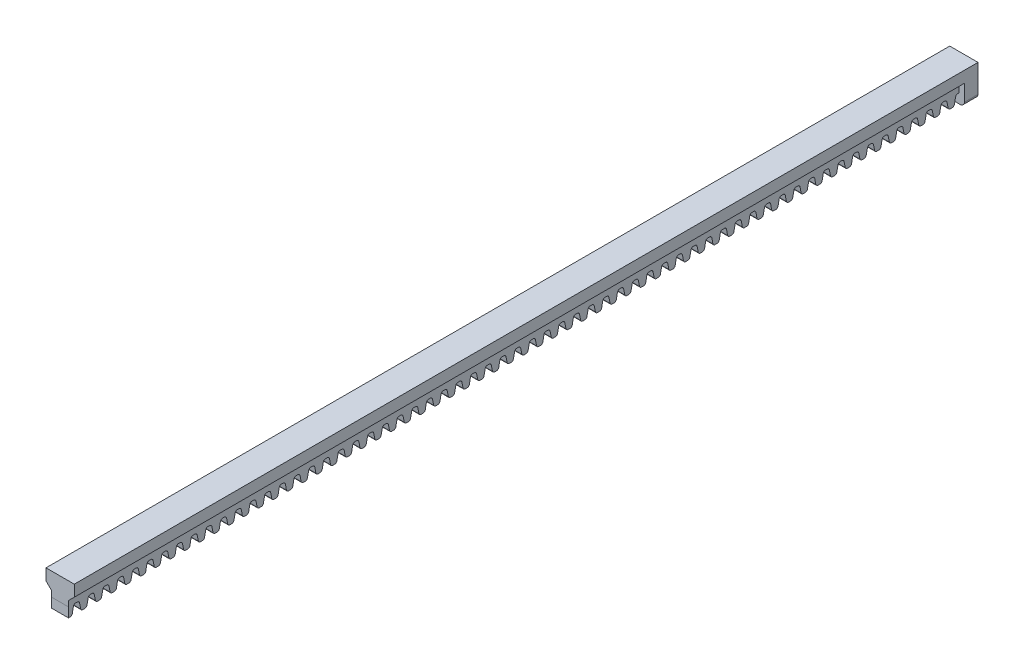
from build123d import *

# Parameters (mm, degrees)
BOSS_EXTRUDE1_DEPTH = 200
BOSS_EXTRUDE2_DEPTH = 3.81
BOSS_EXTRUDE4_DEPTH = 3


with BuildPart() as part:
    # Sketch1 → Boss-Extrude1 (new body)
    with BuildSketch(Plane.XY):
        Polygon((3.175, 2.539999459), (-3.175, 2.539999459), (-3.175, 1.407e-06), (-1.904999134, -1.269999459), (-1.904999134, -2.539999459), (1.905000866, -2.539999459), (1.905000866, -1.269999459), (3.175, -3.24e-07), align=None)
    extrude(amount=BOSS_EXTRUDE1_DEPTH)

    # Sketch2 → Boss-Extrude2 (add)
    with BuildSketch(Plane(origin=(1.905000866, 0, 0), x_dir=(0, 0, -1), z_dir=(1, 0, 0))):
        with BuildLine():
            Line((-4.064881682, -2.948372301), (-4.325343917, -4.250650878))
            ThreePointArc((-4.325343917, -4.250650878), (-4.468915028, -4.51481168), (-4.736685634, -4.651532184))
            Line((-4.736685634, -4.651532184), (-5.240538597, -4.658999528))
            ThreePointArc((-5.240538597, -4.658999528), (-5.562610137, -4.543859094), (-5.738684416, -4.250626687))
            Line((-5.738684416, -4.250626687), (-5.999125028, -2.948381715))
            ThreePointArc((-5.999125028, -2.948381715), (-6.175195708, -2.655144387), (-6.497268154, -2.539999459))
            Line((-6.497268154, -2.539999459), (-3.566740439, -2.539999459))
            ThreePointArc((-3.566740439, -2.539999459), (-3.888809172, -2.655141344), (-4.064881682, -2.948372301))
        make_face()
        with BuildLine():
            Line((-109.728874147, -2.9483723), (-109.989331543, -4.250626687))
            ThreePointArc((-109.989331543, -4.250626687), (-110.132898659, -4.514803071), (-110.400678098, -4.651532184))
            Line((-110.400678098, -4.651532184), (-110.904531062, -4.658999529))
            ThreePointArc((-110.904531062, -4.658999529), (-111.226602601, -4.543859094), (-111.40267688, -4.250626687))
            Line((-111.40267688, -4.250626687), (-111.663119376, -2.9483723))
            ThreePointArc((-111.663119376, -2.9483723), (-111.839191885, -2.655141344), (-112.161260619, -2.539999459))
            Line((-112.161260619, -2.539999459), (-109.230743229, -2.539999459))
            ThreePointArc((-109.230743229, -2.539999459), (-109.55280563, -2.655144617), (-109.728874147, -2.9483723))
        make_face()
        with BuildLine():
            Line((-6.868743777, -2.539999459), (-9.799276068, -2.539999459))
            ThreePointArc((-9.799276068, -2.539999459), (-9.477207334, -2.655141344), (-9.301134825, -2.948372301))
            Line((-9.301134825, -2.948372301), (-9.040677428, -4.250626687))
            ThreePointArc((-9.040677428, -4.250626687), (-8.897102224, -4.514800551), (-8.629321237, -4.651530257))
            Line((-8.629321237, -4.651530257), (-8.125468274, -4.658997601))
            ThreePointArc((-8.125468274, -4.658997601), (-7.803396734, -4.543857167), (-7.627322455, -4.25062476))
            Line((-7.627322455, -4.25062476), (-7.36687996, -2.948370373))
            ThreePointArc((-7.36687996, -2.948370373), (-7.190810843, -2.655139813), (-6.868743777, -2.539999459))
        make_face()
        with BuildLine():
            Line((-10.668867707, -2.9483723), (-10.929325104, -4.250626687))
            ThreePointArc((-10.929325104, -4.250626687), (-11.072900308, -4.514800551), (-11.340681295, -4.651530257))
            Line((-11.340681295, -4.651530257), (-11.844534258, -4.658997601))
            ThreePointArc((-11.844534258, -4.658997601), (-12.166605798, -4.543857167), (-12.342680077, -4.250624759))
            Line((-12.342680077, -4.250624759), (-12.603122572, -2.948370373))
            ThreePointArc((-12.603122572, -2.948370373), (-12.779190154, -2.655141071), (-13.101254785, -2.539999459))
            Line((-13.101254785, -2.539999459), (-10.17073679, -2.539999459))
            ThreePointArc((-10.17073679, -2.539999459), (-10.49279919, -2.655144617), (-10.668867707, -2.9483723))
        make_face()
        with BuildLine():
            Line((-13.472729802, -2.539999459), (-16.403262093, -2.539999459))
            ThreePointArc((-16.403262093, -2.539999459), (-16.081193359, -2.655141344), (-15.90512085, -2.948372301))
            Line((-15.90512085, -2.948372301), (-15.644663453, -4.250626687))
            ThreePointArc((-15.644663453, -4.250626687), (-15.501088249, -4.514800551), (-15.233307262, -4.651530257))
            Line((-15.233307262, -4.651530257), (-14.729454299, -4.658997601))
            ThreePointArc((-14.729454299, -4.658997601), (-14.407382759, -4.543857167), (-14.23130848, -4.25062476))
            Line((-14.23130848, -4.25062476), (-13.970865985, -2.948370373))
            ThreePointArc((-13.970865985, -2.948370373), (-13.794796867, -2.655139813), (-13.472729802, -2.539999459))
        make_face()
        with BuildLine():
            Line((-17.272898436, -2.9483723), (-17.533355832, -4.250626687))
            ThreePointArc((-17.533355832, -4.250626687), (-17.676931036, -4.514800551), (-17.944712023, -4.651530257))
            Line((-17.944712023, -4.651530257), (-18.448564987, -4.658997601))
            ThreePointArc((-18.448564987, -4.658997601), (-18.770636526, -4.543857167), (-18.946710805, -4.250624759))
            Line((-18.946710805, -4.250624759), (-19.207153301, -2.948370373))
            ThreePointArc((-19.207153301, -2.948370373), (-19.383220883, -2.655141071), (-19.705285514, -2.539999459))
            Line((-19.705285514, -2.539999459), (-16.774767518, -2.539999459))
            ThreePointArc((-16.774767518, -2.539999459), (-17.096829918, -2.655144617), (-17.272898436, -2.9483723))
        make_face()
        with BuildLine():
            Line((-20.07676053, -2.539999459), (-23.007292821, -2.539999459))
            ThreePointArc((-23.007292821, -2.539999459), (-22.685224088, -2.655141344), (-22.509151578, -2.948372301))
            Line((-22.509151578, -2.948372301), (-22.248694181, -4.250626687))
            ThreePointArc((-22.248694181, -4.250626687), (-22.105118977, -4.514800551), (-21.83733799, -4.651530257))
            Line((-21.83733799, -4.651530257), (-21.333485027, -4.658997601))
            ThreePointArc((-21.333485027, -4.658997601), (-21.011413487, -4.543857167), (-20.835339208, -4.25062476))
            Line((-20.835339208, -4.25062476), (-20.574896713, -2.948370373))
            ThreePointArc((-20.574896713, -2.948370373), (-20.398827596, -2.655139813), (-20.07676053, -2.539999459))
        make_face()
        with BuildLine():
            Line((-23.87688446, -2.9483723), (-24.137341857, -4.250626687))
            ThreePointArc((-24.137341857, -4.250626687), (-24.280917061, -4.514800551), (-24.548698048, -4.651530257))
            Line((-24.548698048, -4.651530257), (-25.052551011, -4.658997601))
            ThreePointArc((-25.052551011, -4.658997601), (-25.374622551, -4.543857167), (-25.55069683, -4.250624759))
            Line((-25.55069683, -4.250624759), (-25.811139326, -2.948370373))
            ThreePointArc((-25.811139326, -2.948370373), (-25.987206908, -2.655141071), (-26.309271538, -2.539999459))
            Line((-26.309271538, -2.539999459), (-23.378753543, -2.539999459))
            ThreePointArc((-23.378753543, -2.539999459), (-23.700815943, -2.655144617), (-23.87688446, -2.9483723))
        make_face()
        with BuildLine():
            Line((-26.680746555, -2.539999459), (-29.611278846, -2.539999459))
            ThreePointArc((-29.611278846, -2.539999459), (-29.289210112, -2.655141344), (-29.113137603, -2.948372301))
            Line((-29.113137603, -2.948372301), (-28.852680206, -4.250626687))
            ThreePointArc((-28.852680206, -4.250626687), (-28.709113091, -4.514803071), (-28.441333652, -4.651532184))
            Line((-28.441333652, -4.651532184), (-27.937480688, -4.658999529))
            ThreePointArc((-27.937480688, -4.658999529), (-27.615409148, -4.543859094), (-27.439334869, -4.250626687))
            Line((-27.439334869, -4.250626687), (-27.178892374, -2.948372301))
            ThreePointArc((-27.178892374, -2.948372301), (-27.002818095, -2.655139893), (-26.680746555, -2.539999459))
        make_face()
        with BuildLine():
            Line((-30.480877936, -2.9483723), (-30.741335332, -4.250626687))
            ThreePointArc((-30.741335332, -4.250626687), (-30.884902448, -4.514803071), (-31.152681887, -4.651532184))
            Line((-31.152681887, -4.651532184), (-31.656534851, -4.658999529))
            ThreePointArc((-31.656534851, -4.658999529), (-31.97860639, -4.543859094), (-32.154680669, -4.250626687))
            Line((-32.154680669, -4.250626687), (-32.415123165, -2.9483723))
            ThreePointArc((-32.415123165, -2.9483723), (-32.591195674, -2.655141344), (-32.913264407, -2.539999459))
            Line((-32.913264407, -2.539999459), (-29.982747018, -2.539999459))
            ThreePointArc((-29.982747018, -2.539999459), (-30.304809419, -2.655144617), (-30.480877936, -2.9483723))
        make_face()
        with BuildLine():
            Line((-33.284740031, -2.539999459), (-36.215272321, -2.539999459))
            ThreePointArc((-36.215272321, -2.539999459), (-35.893203588, -2.655141344), (-35.717131078, -2.948372301))
            Line((-35.717131078, -2.948372301), (-35.456673682, -4.250626687))
            ThreePointArc((-35.456673682, -4.250626687), (-35.313098478, -4.514800551), (-35.045317491, -4.651530257))
            Line((-35.045317491, -4.651530257), (-34.541464527, -4.658997601))
            ThreePointArc((-34.541464527, -4.658997601), (-34.219392987, -4.543857167), (-34.043318709, -4.25062476))
            Line((-34.043318709, -4.25062476), (-33.782876213, -2.948370373))
            ThreePointArc((-33.782876213, -2.948370373), (-33.606807096, -2.655139813), (-33.284740031, -2.539999459))
        make_face()
        with BuildLine():
            Line((-37.084863961, -2.9483723), (-37.345321357, -4.250626687))
            ThreePointArc((-37.345321357, -4.250626687), (-37.488896561, -4.514800551), (-37.756677548, -4.651530257))
            Line((-37.756677548, -4.651530257), (-38.260530512, -4.658997601))
            ThreePointArc((-38.260530512, -4.658997601), (-38.582602052, -4.543857167), (-38.75867633, -4.250624759))
            Line((-38.75867633, -4.250624759), (-39.019118826, -2.948370373))
            ThreePointArc((-39.019118826, -2.948370373), (-39.195186408, -2.655141071), (-39.517251039, -2.539999459))
            Line((-39.517251039, -2.539999459), (-36.586733043, -2.539999459))
            ThreePointArc((-36.586733043, -2.539999459), (-36.908795444, -2.655144617), (-37.084863961, -2.9483723))
        make_face()
        with BuildLine():
            Line((-39.888726056, -2.539999459), (-42.819258346, -2.539999459))
            ThreePointArc((-42.819258346, -2.539999459), (-42.497189613, -2.655141344), (-42.321117103, -2.948372301))
            Line((-42.321117103, -2.948372301), (-42.060659707, -4.250626687))
            ThreePointArc((-42.060659707, -4.250626687), (-41.917084502, -4.514800551), (-41.649303516, -4.651530257))
            Line((-41.649303516, -4.651530257), (-41.145450552, -4.658997601))
            ThreePointArc((-41.145450552, -4.658997601), (-40.823379012, -4.543857167), (-40.647304733, -4.25062476))
            Line((-40.647304733, -4.25062476), (-40.386862238, -2.948370373))
            ThreePointArc((-40.386862238, -2.948370373), (-40.210793121, -2.655139813), (-39.888726056, -2.539999459))
        make_face()
        with BuildLine():
            Line((-43.688894689, -2.9483723), (-43.949352086, -4.250626687))
            ThreePointArc((-43.949352086, -4.250626687), (-44.09292729, -4.514800551), (-44.360708277, -4.651530257))
            Line((-44.360708277, -4.651530257), (-44.86456124, -4.658997601))
            ThreePointArc((-44.86456124, -4.658997601), (-45.18663278, -4.543857167), (-45.362707059, -4.250624759))
            Line((-45.362707059, -4.250624759), (-45.623149554, -2.948370373))
            ThreePointArc((-45.623149554, -2.948370373), (-45.799217136, -2.655141071), (-46.121281767, -2.539999459))
            Line((-46.121281767, -2.539999459), (-43.190763772, -2.539999459))
            ThreePointArc((-43.190763772, -2.539999459), (-43.512826172, -2.655144617), (-43.688894689, -2.9483723))
        make_face()
        with BuildLine():
            Line((-46.492756784, -2.539999459), (-49.423289074, -2.539999459))
            ThreePointArc((-49.423289074, -2.539999459), (-49.101220341, -2.655141344), (-48.925147831, -2.948372301))
            Line((-48.925147831, -2.948372301), (-48.664690435, -4.250626687))
            ThreePointArc((-48.664690435, -4.250626687), (-48.521115231, -4.514800551), (-48.253334244, -4.651530257))
            Line((-48.253334244, -4.651530257), (-47.74948128, -4.658997601))
            ThreePointArc((-47.74948128, -4.658997601), (-47.427409741, -4.543857167), (-47.251335462, -4.25062476))
            Line((-47.251335462, -4.25062476), (-46.990892966, -2.948370373))
            ThreePointArc((-46.990892966, -2.948370373), (-46.814823849, -2.655139813), (-46.492756784, -2.539999459))
        make_face()
        with BuildLine():
            Line((-50.292880714, -2.9483723), (-50.55333811, -4.250626687))
            ThreePointArc((-50.55333811, -4.250626687), (-50.696913315, -4.514800551), (-50.964694302, -4.651530257))
            Line((-50.964694302, -4.651530257), (-51.468547265, -4.658997601))
            ThreePointArc((-51.468547265, -4.658997601), (-51.790618805, -4.543857167), (-51.966693084, -4.250624759))
            Line((-51.966693084, -4.250624759), (-52.227135579, -2.948370373))
            ThreePointArc((-52.227135579, -2.948370373), (-52.403203161, -2.655141071), (-52.725267792, -2.539999459))
            Line((-52.725267792, -2.539999459), (-49.794749796, -2.539999459))
            ThreePointArc((-49.794749796, -2.539999459), (-50.116812197, -2.655144617), (-50.292880714, -2.9483723))
        make_face()
        with BuildLine():
            Line((-53.096742809, -2.539999459), (-56.027275099, -2.539999459))
            ThreePointArc((-56.027275099, -2.539999459), (-55.705206366, -2.655141344), (-55.529133856, -2.948372301))
            Line((-55.529133856, -2.948372301), (-55.26867646, -4.250626687))
            ThreePointArc((-55.26867646, -4.250626687), (-55.125109344, -4.514803071), (-54.857329905, -4.651532184))
            Line((-54.857329905, -4.651532184), (-54.353476942, -4.658999529))
            ThreePointArc((-54.353476942, -4.658999529), (-54.031405402, -4.543859094), (-53.855331123, -4.250626687))
            Line((-53.855331123, -4.250626687), (-53.594888628, -2.948372301))
            ThreePointArc((-53.594888628, -2.948372301), (-53.418814349, -2.655139893), (-53.096742809, -2.539999459))
        make_face()
        with BuildLine():
            Line((-56.896874189, -2.9483723), (-57.157331586, -4.250626687))
            ThreePointArc((-57.157331586, -4.250626687), (-57.300898701, -4.514803071), (-57.568678141, -4.651532184))
            Line((-57.568678141, -4.651532184), (-58.072531104, -4.658999529))
            ThreePointArc((-58.072531104, -4.658999529), (-58.394602644, -4.543859094), (-58.570676923, -4.250626687))
            Line((-58.570676923, -4.250626687), (-58.831119418, -2.9483723))
            ThreePointArc((-58.831119418, -2.9483723), (-59.007191928, -2.655141344), (-59.329260661, -2.539999459))
            Line((-59.329260661, -2.539999459), (-56.398743272, -2.539999459))
            ThreePointArc((-56.398743272, -2.539999459), (-56.720805672, -2.655144617), (-56.896874189, -2.9483723))
        make_face()
        with BuildLine():
            Line((-59.700736284, -2.539999459), (-62.631268575, -2.539999459))
            ThreePointArc((-62.631268575, -2.539999459), (-62.309199841, -2.655141344), (-62.133127332, -2.948372301))
            Line((-62.133127332, -2.948372301), (-61.872669935, -4.250626687))
            ThreePointArc((-61.872669935, -4.250626687), (-61.729094731, -4.514800551), (-61.461313744, -4.651530257))
            Line((-61.461313744, -4.651530257), (-60.957460781, -4.658997601))
            ThreePointArc((-60.957460781, -4.658997601), (-60.635389241, -4.543857167), (-60.459314962, -4.25062476))
            Line((-60.459314962, -4.25062476), (-60.198872467, -2.948370373))
            ThreePointArc((-60.198872467, -2.948370373), (-60.02280335, -2.655139813), (-59.700736284, -2.539999459))
        make_face()
        with BuildLine():
            Line((-63.500860214, -2.9483723), (-63.761317611, -4.250626687))
            ThreePointArc((-63.761317611, -4.250626687), (-63.904892815, -4.514800551), (-64.172673802, -4.651530257))
            Line((-64.172673802, -4.651530257), (-64.676526765, -4.658997601))
            ThreePointArc((-64.676526765, -4.658997601), (-64.998598305, -4.543857167), (-65.174672584, -4.250624759))
            Line((-65.174672584, -4.250624759), (-65.435115079, -2.948370373))
            ThreePointArc((-65.435115079, -2.948370373), (-65.611182661, -2.655141071), (-65.933247292, -2.539999459))
            Line((-65.933247292, -2.539999459), (-63.002729297, -2.539999459))
            ThreePointArc((-63.002729297, -2.539999459), (-63.324791697, -2.655144617), (-63.500860214, -2.9483723))
        make_face()
        with BuildLine():
            Line((-66.304722309, -2.539999459), (-69.2352546, -2.539999459))
            ThreePointArc((-69.2352546, -2.539999459), (-68.913185866, -2.655141344), (-68.737113357, -2.948372301))
            Line((-68.737113357, -2.948372301), (-68.47665596, -4.250626687))
            ThreePointArc((-68.47665596, -4.250626687), (-68.333080756, -4.514800551), (-68.065299769, -4.651530257))
            Line((-68.065299769, -4.651530257), (-67.561446806, -4.658997601))
            ThreePointArc((-67.561446806, -4.658997601), (-67.239375266, -4.543857167), (-67.063300987, -4.25062476))
            Line((-67.063300987, -4.25062476), (-66.802858492, -2.948370373))
            ThreePointArc((-66.802858492, -2.948370373), (-66.626789374, -2.655139813), (-66.304722309, -2.539999459))
        make_face()
        with BuildLine():
            Line((-70.104890943, -2.9483723), (-70.365348339, -4.250626687))
            ThreePointArc((-70.365348339, -4.250626687), (-70.508923543, -4.514800551), (-70.77670453, -4.651530257))
            Line((-70.77670453, -4.651530257), (-71.280557494, -4.658997601))
            ThreePointArc((-71.280557494, -4.658997601), (-71.602629033, -4.543857167), (-71.778703312, -4.250624759))
            Line((-71.778703312, -4.250624759), (-72.039145808, -2.948370373))
            ThreePointArc((-72.039145808, -2.948370373), (-72.21521339, -2.655141071), (-72.53727802, -2.539999459))
            Line((-72.53727802, -2.539999459), (-69.606760025, -2.539999459))
            ThreePointArc((-69.606760025, -2.539999459), (-69.928822425, -2.655144617), (-70.104890943, -2.9483723))
        make_face()
        with BuildLine():
            Line((-72.908753037, -2.539999459), (-75.839285328, -2.539999459))
            ThreePointArc((-75.839285328, -2.539999459), (-75.517216595, -2.655141344), (-75.341144085, -2.948372301))
            Line((-75.341144085, -2.948372301), (-75.080686688, -4.250626687))
            ThreePointArc((-75.080686688, -4.250626687), (-74.937111484, -4.514800551), (-74.669330497, -4.651530257))
            Line((-74.669330497, -4.651530257), (-74.165477534, -4.658997601))
            ThreePointArc((-74.165477534, -4.658997601), (-73.843405994, -4.543857167), (-73.667331715, -4.25062476))
            Line((-73.667331715, -4.25062476), (-73.40688922, -2.948370373))
            ThreePointArc((-73.40688922, -2.948370373), (-73.230820103, -2.655139813), (-72.908753037, -2.539999459))
        make_face()
        with BuildLine():
            Line((-76.708876967, -2.9483723), (-76.969334364, -4.250626687))
            ThreePointArc((-76.969334364, -4.250626687), (-77.112909568, -4.514800551), (-77.380690555, -4.651530257))
            Line((-77.380690555, -4.651530257), (-77.884543518, -4.658997601))
            ThreePointArc((-77.884543518, -4.658997601), (-78.206615058, -4.543857167), (-78.382689337, -4.250624759))
            Line((-78.382689337, -4.250624759), (-78.643131833, -2.948370373))
            ThreePointArc((-78.643131833, -2.948370373), (-78.819199415, -2.655141071), (-79.141264045, -2.539999459))
            Line((-79.141264045, -2.539999459), (-76.21074605, -2.539999459))
            ThreePointArc((-76.21074605, -2.539999459), (-76.53280845, -2.655144617), (-76.708876967, -2.9483723))
        make_face()
        with BuildLine():
            Line((-79.512739062, -2.539999459), (-82.443271353, -2.539999459))
            ThreePointArc((-82.443271353, -2.539999459), (-82.121202619, -2.655141344), (-81.94513011, -2.948372301))
            Line((-81.94513011, -2.948372301), (-81.684672713, -4.250626687))
            ThreePointArc((-81.684672713, -4.250626687), (-81.541105598, -4.514803071), (-81.273326159, -4.651532184))
            Line((-81.273326159, -4.651532184), (-80.769473195, -4.658999529))
            ThreePointArc((-80.769473195, -4.658999529), (-80.447401655, -4.543859094), (-80.271327376, -4.250626687))
            Line((-80.271327376, -4.250626687), (-80.010884881, -2.948372301))
            ThreePointArc((-80.010884881, -2.948372301), (-79.834810602, -2.655139893), (-79.512739062, -2.539999459))
        make_face()
        with BuildLine():
            Line((-83.312870443, -2.9483723), (-83.573327839, -4.250626687))
            ThreePointArc((-83.573327839, -4.250626687), (-83.716894955, -4.514803071), (-83.984674394, -4.651532184))
            Line((-83.984674394, -4.651532184), (-84.488527358, -4.658999529))
            ThreePointArc((-84.488527358, -4.658999529), (-84.810598897, -4.543859094), (-84.986673176, -4.250626687))
            Line((-84.986673176, -4.250626687), (-85.247115672, -2.9483723))
            ThreePointArc((-85.247115672, -2.9483723), (-85.423188181, -2.655141344), (-85.745256914, -2.539999459))
            Line((-85.745256914, -2.539999459), (-82.814739525, -2.539999459))
            ThreePointArc((-82.814739525, -2.539999459), (-83.136801926, -2.655144617), (-83.312870443, -2.9483723))
        make_face()
        with BuildLine():
            Line((-86.116732538, -2.539999459), (-89.047264828, -2.539999459))
            ThreePointArc((-89.047264828, -2.539999459), (-88.725196095, -2.655141344), (-88.549123585, -2.948372301))
            Line((-88.549123585, -2.948372301), (-88.288666189, -4.250626687))
            ThreePointArc((-88.288666189, -4.250626687), (-88.145090985, -4.514800551), (-87.877309998, -4.651530257))
            Line((-87.877309998, -4.651530257), (-87.373457034, -4.658997601))
            ThreePointArc((-87.373457034, -4.658997601), (-87.051385494, -4.543857167), (-86.875311215, -4.25062476))
            Line((-86.875311215, -4.25062476), (-86.61486872, -2.948370373))
            ThreePointArc((-86.61486872, -2.948370373), (-86.438799603, -2.655139813), (-86.116732538, -2.539999459))
        make_face()
        with BuildLine():
            Line((-89.916856468, -2.9483723), (-90.177313864, -4.250626687))
            ThreePointArc((-90.177313864, -4.250626687), (-90.320889068, -4.514800551), (-90.588670055, -4.651530257))
            Line((-90.588670055, -4.651530257), (-91.092523019, -4.658997601))
            ThreePointArc((-91.092523019, -4.658997601), (-91.414594558, -4.543857167), (-91.590668837, -4.250624759))
            Line((-91.590668837, -4.250624759), (-91.851111333, -2.948370373))
            ThreePointArc((-91.851111333, -2.948370373), (-92.027178915, -2.655141071), (-92.349243546, -2.539999459))
            Line((-92.349243546, -2.539999459), (-89.41872555, -2.539999459))
            ThreePointArc((-89.41872555, -2.539999459), (-89.740787951, -2.655144617), (-89.916856468, -2.9483723))
        make_face()
        with BuildLine():
            Line((-92.720718563, -2.539999459), (-95.651250853, -2.539999459))
            ThreePointArc((-95.651250853, -2.539999459), (-95.32918212, -2.655141344), (-95.15310961, -2.948372301))
            Line((-95.15310961, -2.948372301), (-94.892652214, -4.250626687))
            ThreePointArc((-94.892652214, -4.250626687), (-94.749077009, -4.514800551), (-94.481296023, -4.651530257))
            Line((-94.481296023, -4.651530257), (-93.977443059, -4.658997601))
            ThreePointArc((-93.977443059, -4.658997601), (-93.655371519, -4.543857167), (-93.47929724, -4.25062476))
            Line((-93.47929724, -4.25062476), (-93.218854745, -2.948370373))
            ThreePointArc((-93.218854745, -2.948370373), (-93.042785628, -2.655139813), (-92.720718563, -2.539999459))
        make_face()
        with BuildLine():
            Line((-96.520887196, -2.9483723), (-96.781344593, -4.250626687))
            ThreePointArc((-96.781344593, -4.250626687), (-96.924919797, -4.514800551), (-97.192700784, -4.651530257))
            Line((-97.192700784, -4.651530257), (-97.696553747, -4.658997601))
            ThreePointArc((-97.696553747, -4.658997601), (-98.018625287, -4.543857167), (-98.194699566, -4.250624759))
            Line((-98.194699566, -4.250624759), (-98.455142061, -2.948370373))
            ThreePointArc((-98.455142061, -2.948370373), (-98.631209643, -2.655141071), (-98.953274274, -2.539999459))
            Line((-98.953274274, -2.539999459), (-96.022756279, -2.539999459))
            ThreePointArc((-96.022756279, -2.539999459), (-96.344818679, -2.655144617), (-96.520887196, -2.9483723))
        make_face()
        with BuildLine():
            Line((-99.324749291, -2.539999459), (-102.255281581, -2.539999459))
            ThreePointArc((-102.255281581, -2.539999459), (-101.933212848, -2.655141344), (-101.757140338, -2.948372301))
            Line((-101.757140338, -2.948372301), (-101.496682942, -4.250626687))
            ThreePointArc((-101.496682942, -4.250626687), (-101.353107738, -4.514800551), (-101.085326751, -4.651530257))
            Line((-101.085326751, -4.651530257), (-100.581473787, -4.658997601))
            ThreePointArc((-100.581473787, -4.658997601), (-100.259402248, -4.543857167), (-100.083327969, -4.25062476))
            Line((-100.083327969, -4.25062476), (-99.822885473, -2.948370373))
            ThreePointArc((-99.822885473, -2.948370373), (-99.646816356, -2.655139813), (-99.324749291, -2.539999459))
        make_face()
        with BuildLine():
            Line((-103.124873221, -2.9483723), (-103.385330617, -4.250626687))
            ThreePointArc((-103.385330617, -4.250626687), (-103.528905822, -4.514800551), (-103.796686808, -4.651530257))
            Line((-103.796686808, -4.651530257), (-104.300539772, -4.658997601))
            ThreePointArc((-104.300539772, -4.658997601), (-104.622611312, -4.543857167), (-104.798685591, -4.250624759))
            Line((-104.798685591, -4.250624759), (-105.059128086, -2.948370373))
            ThreePointArc((-105.059128086, -2.948370373), (-105.235195668, -2.655141071), (-105.557260299, -2.539999459))
            Line((-105.557260299, -2.539999459), (-102.626742303, -2.539999459))
            ThreePointArc((-102.626742303, -2.539999459), (-102.948804704, -2.655144617), (-103.124873221, -2.9483723))
        make_face()
        with BuildLine():
            Line((-105.928735316, -2.539999459), (-108.859267606, -2.539999459))
            ThreePointArc((-108.859267606, -2.539999459), (-108.537198873, -2.655141344), (-108.361126363, -2.948372301))
            Line((-108.361126363, -2.948372301), (-108.100668967, -4.250626687))
            ThreePointArc((-108.100668967, -4.250626687), (-107.957101851, -4.514803071), (-107.689322412, -4.651532184))
            Line((-107.689322412, -4.651532184), (-107.185469449, -4.658999529))
            ThreePointArc((-107.185469449, -4.658999529), (-106.863397909, -4.543859094), (-106.68732363, -4.250626687))
            Line((-106.68732363, -4.250626687), (-106.426881135, -2.948372301))
            ThreePointArc((-106.426881135, -2.948372301), (-106.250806856, -2.655139893), (-105.928735316, -2.539999459))
        make_face()
        with BuildLine():
            Line((-112.532736242, -2.539999459), (-115.463268532, -2.539999459))
            ThreePointArc((-115.463268532, -2.539999459), (-115.141199799, -2.655141344), (-114.965127289, -2.948372301))
            Line((-114.965127289, -2.948372301), (-114.704669893, -4.250626687))
            ThreePointArc((-114.704669893, -4.250626687), (-114.561094689, -4.514800551), (-114.293313702, -4.651530257))
            Line((-114.293313702, -4.651530257), (-113.789460738, -4.658997601))
            ThreePointArc((-113.789460738, -4.658997601), (-113.467389199, -4.543857167), (-113.29131492, -4.25062476))
            Line((-113.29131492, -4.25062476), (-113.030872424, -2.948370373))
            ThreePointArc((-113.030872424, -2.948370373), (-112.854803307, -2.655139813), (-112.532736242, -2.539999459))
        make_face()
        with BuildLine():
            Line((-116.332860172, -2.9483723), (-116.593317568, -4.250626687))
            ThreePointArc((-116.593317568, -4.250626687), (-116.736892772, -4.514800551), (-117.004673759, -4.651530257))
            Line((-117.004673759, -4.651530257), (-117.508526723, -4.658997601))
            ThreePointArc((-117.508526723, -4.658997601), (-117.830598263, -4.543857167), (-118.006672542, -4.250624759))
            Line((-118.006672542, -4.250624759), (-118.267115037, -2.948370373))
            ThreePointArc((-118.267115037, -2.948370373), (-118.443182619, -2.655141071), (-118.76524725, -2.539999459))
            Line((-118.76524725, -2.539999459), (-115.834729254, -2.539999459))
            ThreePointArc((-115.834729254, -2.539999459), (-116.156791655, -2.655144617), (-116.332860172, -2.9483723))
        make_face()
        with BuildLine():
            Line((-119.136722267, -2.539999459), (-122.067254557, -2.539999459))
            ThreePointArc((-122.067254557, -2.539999459), (-121.745185824, -2.655141344), (-121.569113314, -2.948372301))
            Line((-121.569113314, -2.948372301), (-121.308655918, -4.250626687))
            ThreePointArc((-121.308655918, -4.250626687), (-121.165080714, -4.514800551), (-120.897299727, -4.651530257))
            Line((-120.897299727, -4.651530257), (-120.393446763, -4.658997601))
            ThreePointArc((-120.393446763, -4.658997601), (-120.071375223, -4.543857167), (-119.895300944, -4.25062476))
            Line((-119.895300944, -4.25062476), (-119.634858449, -2.948370373))
            ThreePointArc((-119.634858449, -2.948370373), (-119.458789332, -2.655139813), (-119.136722267, -2.539999459))
        make_face()
        with BuildLine():
            Line((-122.9368909, -2.9483723), (-123.197348297, -4.250626687))
            ThreePointArc((-123.197348297, -4.250626687), (-123.340923501, -4.514800551), (-123.608704488, -4.651530257))
            Line((-123.608704488, -4.651530257), (-124.112557451, -4.658997601))
            ThreePointArc((-124.112557451, -4.658997601), (-124.434628991, -4.543857167), (-124.61070327, -4.250624759))
            Line((-124.61070327, -4.250624759), (-124.871145765, -2.948370373))
            ThreePointArc((-124.871145765, -2.948370373), (-125.047213347, -2.655141071), (-125.369277978, -2.539999459))
            Line((-125.369277978, -2.539999459), (-122.438759983, -2.539999459))
            ThreePointArc((-122.438759983, -2.539999459), (-122.760822383, -2.655144617), (-122.9368909, -2.9483723))
        make_face()
        with BuildLine():
            Line((-125.740752995, -2.539999459), (-128.671285285, -2.539999459))
            ThreePointArc((-128.671285285, -2.539999459), (-128.349216552, -2.655141344), (-128.173144042, -2.948372301))
            Line((-128.173144042, -2.948372301), (-127.912686646, -4.250626687))
            ThreePointArc((-127.912686646, -4.250626687), (-127.769111442, -4.514800551), (-127.501330455, -4.651530257))
            Line((-127.501330455, -4.651530257), (-126.997477491, -4.658997601))
            ThreePointArc((-126.997477491, -4.658997601), (-126.675405952, -4.543857167), (-126.499331673, -4.25062476))
            Line((-126.499331673, -4.25062476), (-126.238889177, -2.948370373))
            ThreePointArc((-126.238889177, -2.948370373), (-126.06282006, -2.655139813), (-125.740752995, -2.539999459))
        make_face()
        with BuildLine():
            Line((-129.540876925, -2.9483723), (-129.801334321, -4.250626687))
            ThreePointArc((-129.801334321, -4.250626687), (-129.944909526, -4.514800551), (-130.212690513, -4.651530257))
            Line((-130.212690513, -4.651530257), (-130.716543476, -4.658997601))
            ThreePointArc((-130.716543476, -4.658997601), (-131.038615016, -4.543857167), (-131.214689295, -4.250624759))
            Line((-131.214689295, -4.250624759), (-131.47513179, -2.948370373))
            ThreePointArc((-131.47513179, -2.948370373), (-131.651199372, -2.655141071), (-131.973264003, -2.539999459))
            Line((-131.973264003, -2.539999459), (-129.042735682, -2.539999459))
            ThreePointArc((-129.042735682, -2.539999459), (-129.364804415, -2.655141344), (-129.540876925, -2.9483723))
        make_face()
        with BuildLine():
            Line((-198.419244363, -2.539999459), (-200, -2.539999459))
            Line((-200, -2.539999459), (-200.031326522, -4.65373097))
            Line((-200.031326522, -4.65373097), (-199.67596489, -4.658997601))
            ThreePointArc((-199.67596489, -4.658997601), (-199.35389335, -4.543857167), (-199.177819071, -4.250624759))
            Line((-199.177819071, -4.250624759), (-198.917376576, -2.948370373))
            ThreePointArc((-198.917376576, -2.948370373), (-198.741308994, -2.655141071), (-198.419244363, -2.539999459))
        make_face()
        with BuildLine():
            Line((-175.80336807, -2.948372301), (-176.063825466, -4.250626687))
            ThreePointArc((-176.063825466, -4.250626687), (-176.20740067, -4.514800551), (-176.475181657, -4.651530257))
            Line((-176.475181657, -4.651530257), (-176.979034621, -4.658997601))
            ThreePointArc((-176.979034621, -4.658997601), (-177.301106161, -4.543857167), (-177.47718044, -4.25062476))
            Line((-177.47718044, -4.25062476), (-177.737622935, -2.948370373))
            ThreePointArc((-177.737622935, -2.948370373), (-177.913692052, -2.655139813), (-178.235759117, -2.539999459))
            Line((-178.235759117, -2.539999459), (-175.305226827, -2.539999459))
            ThreePointArc((-175.305226827, -2.539999459), (-175.62729556, -2.655141344), (-175.80336807, -2.948372301))
        make_face()
        with BuildLine():
            Line((-0.26509178, -2.539999459), (-3.195619496, -2.539999459))
            ThreePointArc((-3.195619496, -2.539999459), (-2.873550762, -2.655141344), (-2.697478253, -2.948372301))
            Line((-2.697478253, -2.948372301), (-2.437016018, -4.250650878))
            ThreePointArc((-2.437016018, -4.250650878), (-2.293444906, -4.51481168), (-2.025674301, -4.651532184))
            Line((-2.025674301, -4.651532184), (-1.521821337, -4.658999528))
            ThreePointArc((-1.521821337, -4.658999528), (-1.199749798, -4.543859094), (-1.023675519, -4.250626687))
            Line((-1.023675519, -4.250626687), (-0.763234906, -2.948381715))
            ThreePointArc((-0.763234906, -2.948381715), (-0.587164226, -2.655144387), (-0.26509178, -2.539999459))
        make_face()
        with BuildLine():
            Line((-178.607234741, -2.539999459), (-181.53775213, -2.539999459))
            ThreePointArc((-181.53775213, -2.539999459), (-181.215689729, -2.655144617), (-181.039621212, -2.9483723))
            Line((-181.039621212, -2.9483723), (-180.779163816, -4.250626687))
            ThreePointArc((-180.779163816, -4.250626687), (-180.6355967, -4.514803071), (-180.367817261, -4.651532184))
            Line((-180.367817261, -4.651532184), (-179.863964298, -4.658999529))
            ThreePointArc((-179.863964298, -4.658999529), (-179.541892758, -4.543859094), (-179.365818479, -4.250626687))
            Line((-179.365818479, -4.250626687), (-179.105375983, -2.9483723))
            ThreePointArc((-179.105375983, -2.9483723), (-178.929303474, -2.655141344), (-178.607234741, -2.539999459))
        make_face()
        with BuildLine():
            Line((-182.407361545, -2.948372301), (-182.667818942, -4.250626687))
            ThreePointArc((-182.667818942, -4.250626687), (-182.811386057, -4.514803071), (-183.079165497, -4.651532184))
            Line((-183.079165497, -4.651532184), (-183.58301846, -4.658999529))
            ThreePointArc((-183.58301846, -4.658999529), (-183.90509, -4.543859094), (-184.081164279, -4.250626687))
            Line((-184.081164279, -4.250626687), (-184.341606774, -2.948372301))
            ThreePointArc((-184.341606774, -2.948372301), (-184.517681053, -2.655139893), (-184.839752593, -2.539999459))
            Line((-184.839752593, -2.539999459), (-181.909220302, -2.539999459))
            ThreePointArc((-181.909220302, -2.539999459), (-182.231289036, -2.655141344), (-182.407361545, -2.948372301))
        make_face()
        with BuildLine():
            Line((-185.21122761, -2.539999459), (-188.141745605, -2.539999459))
            ThreePointArc((-188.141745605, -2.539999459), (-187.819683205, -2.655144617), (-187.643614688, -2.9483723))
            Line((-187.643614688, -2.9483723), (-187.383157291, -4.250626687))
            ThreePointArc((-187.383157291, -4.250626687), (-187.239582087, -4.514800551), (-186.9718011, -4.651530257))
            Line((-186.9718011, -4.651530257), (-186.467948137, -4.658997601))
            ThreePointArc((-186.467948137, -4.658997601), (-186.145876597, -4.543857167), (-185.969802318, -4.250624759))
            Line((-185.969802318, -4.250624759), (-185.709359823, -2.948370373))
            ThreePointArc((-185.709359823, -2.948370373), (-185.53329224, -2.655141071), (-185.21122761, -2.539999459))
        make_face()
        with BuildLine():
            Line((-189.01134757, -2.948372301), (-189.271804967, -4.250626687))
            ThreePointArc((-189.271804967, -4.250626687), (-189.415380171, -4.514800551), (-189.683161158, -4.651530257))
            Line((-189.683161158, -4.651530257), (-190.187014121, -4.658997601))
            ThreePointArc((-190.187014121, -4.658997601), (-190.509085661, -4.543857167), (-190.68515994, -4.25062476))
            Line((-190.68515994, -4.25062476), (-190.945602435, -2.948370373))
            ThreePointArc((-190.945602435, -2.948370373), (-191.121671552, -2.655139813), (-191.443738618, -2.539999459))
            Line((-191.443738618, -2.539999459), (-188.513206327, -2.539999459))
            ThreePointArc((-188.513206327, -2.539999459), (-188.835275061, -2.655141344), (-189.01134757, -2.948372301))
        make_face()
        with BuildLine():
            Line((-191.815213635, -2.539999459), (-194.74573163, -2.539999459))
            ThreePointArc((-194.74573163, -2.539999459), (-194.42366923, -2.655144617), (-194.247600713, -2.9483723))
            Line((-194.247600713, -2.9483723), (-193.987143316, -4.250626687))
            ThreePointArc((-193.987143316, -4.250626687), (-193.843568112, -4.514800551), (-193.575787125, -4.651530257))
            Line((-193.575787125, -4.651530257), (-193.071934161, -4.658997601))
            ThreePointArc((-193.071934161, -4.658997601), (-192.749862622, -4.543857167), (-192.573788343, -4.250624759))
            Line((-192.573788343, -4.250624759), (-192.313345847, -2.948370373))
            ThreePointArc((-192.313345847, -2.948370373), (-192.137278265, -2.655141071), (-191.815213635, -2.539999459))
        make_face()
        with BuildLine():
            Line((-195.615378299, -2.948372301), (-195.875835695, -4.250626687))
            ThreePointArc((-195.875835695, -4.250626687), (-196.019410899, -4.514800551), (-196.287191886, -4.651530257))
            Line((-196.287191886, -4.651530257), (-196.79104485, -4.658997601))
            ThreePointArc((-196.79104485, -4.658997601), (-197.113116389, -4.543857167), (-197.289190668, -4.25062476))
            Line((-197.289190668, -4.25062476), (-197.549633164, -2.948370373))
            ThreePointArc((-197.549633164, -2.948370373), (-197.725702281, -2.655139813), (-198.047769346, -2.539999459))
            Line((-198.047769346, -2.539999459), (-195.117237056, -2.539999459))
            ThreePointArc((-195.117237056, -2.539999459), (-195.439305789, -2.655141344), (-195.615378299, -2.948372301))
        make_face()
        with BuildLine():
            Line((-152.191231037, -2.539999459), (-155.121748426, -2.539999459))
            ThreePointArc((-155.121748426, -2.539999459), (-154.799686025, -2.655144617), (-154.623617508, -2.9483723))
            Line((-154.623617508, -2.9483723), (-154.363160112, -4.250626687))
            ThreePointArc((-154.363160112, -4.250626687), (-154.219592996, -4.514803071), (-153.951813557, -4.651532184))
            Line((-153.951813557, -4.651532184), (-153.447960593, -4.658999529))
            ThreePointArc((-153.447960593, -4.658999529), (-153.125889054, -4.543859094), (-152.949814775, -4.250626687))
            Line((-152.949814775, -4.250626687), (-152.689372279, -2.9483723))
            ThreePointArc((-152.689372279, -2.9483723), (-152.51329977, -2.655141344), (-152.191231037, -2.539999459))
        make_face()
        with BuildLine():
            Line((-155.991365292, -2.948372301), (-156.251822688, -4.250626687))
            ThreePointArc((-156.251822688, -4.250626687), (-156.395389804, -4.514803071), (-156.663169243, -4.651532184))
            Line((-156.663169243, -4.651532184), (-157.167022207, -4.658999529))
            ThreePointArc((-157.167022207, -4.658999529), (-157.489093746, -4.543859094), (-157.665168025, -4.250626687))
            Line((-157.665168025, -4.250626687), (-157.925610521, -2.948372301))
            ThreePointArc((-157.925610521, -2.948372301), (-158.1016848, -2.655139893), (-158.423756339, -2.539999459))
            Line((-158.423756339, -2.539999459), (-155.493224049, -2.539999459))
            ThreePointArc((-155.493224049, -2.539999459), (-155.815292782, -2.655141344), (-155.991365292, -2.948372301))
        make_face()
        with BuildLine():
            Line((-158.795231356, -2.539999459), (-161.725749352, -2.539999459))
            ThreePointArc((-161.725749352, -2.539999459), (-161.403686951, -2.655144617), (-161.227618434, -2.9483723))
            Line((-161.227618434, -2.9483723), (-160.967161038, -4.250626687))
            ThreePointArc((-160.967161038, -4.250626687), (-160.823585834, -4.514800551), (-160.555804847, -4.651530257))
            Line((-160.555804847, -4.651530257), (-160.051951883, -4.658997601))
            ThreePointArc((-160.051951883, -4.658997601), (-159.729880343, -4.543857167), (-159.553806064, -4.250624759))
            Line((-159.553806064, -4.250624759), (-159.293363569, -2.948370373))
            ThreePointArc((-159.293363569, -2.948370373), (-159.117295987, -2.655141071), (-158.795231356, -2.539999459))
        make_face()
        with BuildLine():
            Line((-162.595351317, -2.948372301), (-162.855808713, -4.250626687))
            ThreePointArc((-162.855808713, -4.250626687), (-162.999383917, -4.514800551), (-163.267164904, -4.651530257))
            Line((-163.267164904, -4.651530257), (-163.771017868, -4.658997601))
            ThreePointArc((-163.771017868, -4.658997601), (-164.093089407, -4.543857167), (-164.269163686, -4.25062476))
            Line((-164.269163686, -4.25062476), (-164.529606182, -2.948370373))
            ThreePointArc((-164.529606182, -2.948370373), (-164.705675299, -2.655139813), (-165.027742364, -2.539999459))
            Line((-165.027742364, -2.539999459), (-162.097210074, -2.539999459))
            ThreePointArc((-162.097210074, -2.539999459), (-162.419278807, -2.655141344), (-162.595351317, -2.948372301))
        make_face()
        with BuildLine():
            Line((-165.399217381, -2.539999459), (-168.329735377, -2.539999459))
            ThreePointArc((-168.329735377, -2.539999459), (-168.007672976, -2.655144617), (-167.831604459, -2.9483723))
            Line((-167.831604459, -2.9483723), (-167.571147063, -4.250626687))
            ThreePointArc((-167.571147063, -4.250626687), (-167.427571858, -4.514800551), (-167.159790871, -4.651530257))
            Line((-167.159790871, -4.651530257), (-166.655937908, -4.658997601))
            ThreePointArc((-166.655937908, -4.658997601), (-166.333866368, -4.543857167), (-166.157792089, -4.250624759))
            Line((-166.157792089, -4.250624759), (-165.897349594, -2.948370373))
            ThreePointArc((-165.897349594, -2.948370373), (-165.721282012, -2.655141071), (-165.399217381, -2.539999459))
        make_face()
        with BuildLine():
            Line((-169.199382045, -2.948372301), (-169.459839442, -4.250626687))
            ThreePointArc((-169.459839442, -4.250626687), (-169.603414646, -4.514800551), (-169.871195633, -4.651530257))
            Line((-169.871195633, -4.651530257), (-170.375048596, -4.658997601))
            ThreePointArc((-170.375048596, -4.658997601), (-170.697120136, -4.543857167), (-170.873194415, -4.25062476))
            Line((-170.873194415, -4.25062476), (-171.13363691, -2.948370373))
            ThreePointArc((-171.13363691, -2.948370373), (-171.309706027, -2.655139813), (-171.631773092, -2.539999459))
            Line((-171.631773092, -2.539999459), (-168.701240802, -2.539999459))
            ThreePointArc((-168.701240802, -2.539999459), (-169.023309535, -2.655141344), (-169.199382045, -2.948372301))
        make_face()
        with BuildLine():
            Line((-172.003248109, -2.539999459), (-174.933766105, -2.539999459))
            ThreePointArc((-174.933766105, -2.539999459), (-174.611703704, -2.655144617), (-174.435635187, -2.9483723))
            Line((-174.435635187, -2.9483723), (-174.175177791, -4.250626687))
            ThreePointArc((-174.175177791, -4.250626687), (-174.031602587, -4.514800551), (-173.7638216, -4.651530257))
            Line((-173.7638216, -4.651530257), (-173.259968636, -4.658997601))
            ThreePointArc((-173.259968636, -4.658997601), (-172.937897097, -4.543857167), (-172.761822818, -4.250624759))
            Line((-172.761822818, -4.250624759), (-172.501380322, -2.948370373))
            ThreePointArc((-172.501380322, -2.948370373), (-172.32531274, -2.655141071), (-172.003248109, -2.539999459))
        make_face()
        with BuildLine():
            Line((-132.379227652, -2.539999459), (-135.309755973, -2.539999459))
            ThreePointArc((-135.309755973, -2.539999459), (-134.98768724, -2.655141344), (-134.81161473, -2.9483723))
            Line((-134.81161473, -2.9483723), (-134.551157334, -4.250626687))
            ThreePointArc((-134.551157334, -4.250626687), (-134.407582129, -4.514800551), (-134.139801143, -4.651530257))
            Line((-134.139801143, -4.651530257), (-133.635948179, -4.658997601))
            ThreePointArc((-133.635948179, -4.658997601), (-133.313876639, -4.543857167), (-133.13780236, -4.250624759))
            Line((-133.13780236, -4.250624759), (-132.877359865, -2.948370373))
            ThreePointArc((-132.877359865, -2.948370373), (-132.701292283, -2.655141071), (-132.379227652, -2.539999459))
        make_face()
        with BuildLine():
            Line((-136.179347613, -2.948372301), (-136.439805009, -4.250626687))
            ThreePointArc((-136.439805009, -4.250626687), (-136.583380213, -4.514800551), (-136.8511612, -4.651530257))
            Line((-136.8511612, -4.651530257), (-137.355014164, -4.658997601))
            ThreePointArc((-137.355014164, -4.658997601), (-137.677085703, -4.543857167), (-137.853159982, -4.25062476))
            Line((-137.853159982, -4.25062476), (-138.113602478, -2.948370373))
            ThreePointArc((-138.113602478, -2.948370373), (-138.289671595, -2.655139813), (-138.61173866, -2.539999459))
            Line((-138.61173866, -2.539999459), (-135.68120637, -2.539999459))
            ThreePointArc((-135.68120637, -2.539999459), (-136.003275103, -2.655141344), (-136.179347613, -2.948372301))
        make_face()
        with BuildLine():
            Line((-138.983213677, -2.539999459), (-141.913731673, -2.539999459))
            ThreePointArc((-141.913731673, -2.539999459), (-141.591669272, -2.655144617), (-141.415600755, -2.9483723))
            Line((-141.415600755, -2.9483723), (-141.155143358, -4.250626687))
            ThreePointArc((-141.155143358, -4.250626687), (-141.011568154, -4.514800551), (-140.743787167, -4.651530257))
            Line((-140.743787167, -4.651530257), (-140.239934204, -4.658997601))
            ThreePointArc((-140.239934204, -4.658997601), (-139.917862664, -4.543857167), (-139.741788385, -4.250624759))
            Line((-139.741788385, -4.250624759), (-139.48134589, -2.948370373))
            ThreePointArc((-139.48134589, -2.948370373), (-139.305278308, -2.655141071), (-138.983213677, -2.539999459))
        make_face()
        with BuildLine():
            Line((-142.783378341, -2.948372301), (-143.043835737, -4.250626687))
            ThreePointArc((-143.043835737, -4.250626687), (-143.187410942, -4.514800551), (-143.455191929, -4.651530257))
            Line((-143.455191929, -4.651530257), (-143.959044892, -4.658997601))
            ThreePointArc((-143.959044892, -4.658997601), (-144.281116432, -4.543857167), (-144.457190711, -4.25062476))
            Line((-144.457190711, -4.25062476), (-144.717633206, -2.948370373))
            ThreePointArc((-144.717633206, -2.948370373), (-144.893702323, -2.655139813), (-145.215769388, -2.539999459))
            Line((-145.215769388, -2.539999459), (-142.285237098, -2.539999459))
            ThreePointArc((-142.285237098, -2.539999459), (-142.607305831, -2.655141344), (-142.783378341, -2.948372301))
        make_face()
        with BuildLine():
            Line((-145.587244405, -2.539999459), (-148.517762401, -2.539999459))
            ThreePointArc((-148.517762401, -2.539999459), (-148.1957, -2.655144617), (-148.019631483, -2.9483723))
            Line((-148.019631483, -2.9483723), (-147.759174087, -4.250626687))
            ThreePointArc((-147.759174087, -4.250626687), (-147.615598883, -4.514800551), (-147.347817896, -4.651530257))
            Line((-147.347817896, -4.651530257), (-146.843964932, -4.658997601))
            ThreePointArc((-146.843964932, -4.658997601), (-146.521893393, -4.543857167), (-146.345819114, -4.250624759))
            Line((-146.345819114, -4.250624759), (-146.085376618, -2.948370373))
            ThreePointArc((-146.085376618, -2.948370373), (-145.909309036, -2.655141071), (-145.587244405, -2.539999459))
        make_face()
        with BuildLine():
            Line((-149.387364366, -2.948372301), (-149.647821762, -4.250626687))
            ThreePointArc((-149.647821762, -4.250626687), (-149.791396966, -4.514800551), (-150.059177953, -4.651530257))
            Line((-150.059177953, -4.651530257), (-150.563030917, -4.658997601))
            ThreePointArc((-150.563030917, -4.658997601), (-150.885102457, -4.543857167), (-151.061176736, -4.25062476))
            Line((-151.061176736, -4.25062476), (-151.321619231, -2.948370373))
            ThreePointArc((-151.321619231, -2.948370373), (-151.497688348, -2.655139813), (-151.819755413, -2.539999459))
            Line((-151.819755413, -2.539999459), (-148.889223123, -2.539999459))
            ThreePointArc((-148.889223123, -2.539999459), (-149.211291856, -2.655141344), (-149.387364366, -2.948372301))
        make_face()
    extrude(amount=-BOSS_EXTRUDE2_DEPTH)

    # Sketch3 → Boss-Extrude4 (add)
    with BuildSketch(Plane(origin=(0, 0, 0), x_dir=(-1, 0, 0), z_dir=(0, 0, -1))):
        with BuildLine():
            Line((-3.175, 2.539999459), (-3.175, -3.683666236))
            ThreePointArc((-3.175, -3.683666236), (-2.741998572, -4.434358315), (-1.905000866, -4.658999528))
            Line((-1.905000866, -4.658999528), (-1.905000866, -4.651532184))
            Line((-1.905000866, -4.651532184), (1.904999134, -4.651532184))
            Line((1.904999134, -4.651532184), (1.904999134, -4.658999528))
            ThreePointArc((1.904999134, -4.658999528), (2.741997706, -4.434358674), (3.175, -3.683666236))
            Line((3.175, -3.683666236), (3.175, 2.539999459))
            Line((3.175, 2.539999459), (-3.175, 2.539999459))
        make_face()
    extrude(amount=BOSS_EXTRUDE4_DEPTH)


solid = part.part
